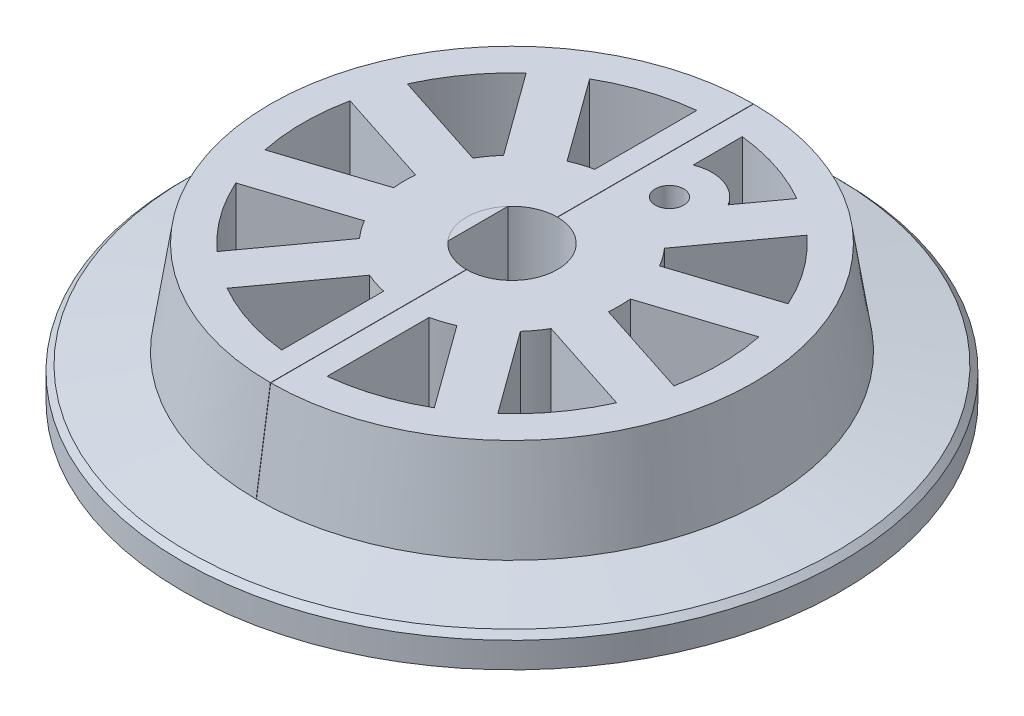
from build123d import *

# Parameters (mm, degrees)
SKETCH_4_R               = 11.6
SKETCH_4_R_2             = 1.6
EXTRUDE_1_DEPTH          = 1.1
EXTRUDE_START            = 1.5
SKETCH_4_3_R             = 9
SKETCH_4_3_R_2           = 1.6
EXTRUDE_2_DEPTH          = 3.3
CHAMFER_1_SIZE           = 0.2
SKETCH_4_4_R             = 1.6
CUT_EXTRUDE_2_DEPTH      = 18.092688495
CHAMFER_2_SIZE           = 0.5
CHAMFER_2_SIZE_2         = 3.3
CUT_EXTRUDE_4_DEPTH      = 18.092688495
EXTRUDE_3_DEPTH          = 4.8
PATTERN_CIRCULAR_2_COUNT = 10
SKETCH_6_R               = 1.5
EXTRUDE_4_DEPTH          = 4.8
SKETCH_6_3_R             = 0.5
CUT_EXTRUDE_5_DEPTH      = 18.092688495
EXTRUDE_5_DEPTH          = 4.8
SKETCH_7_W               = 0.01
SKETCH_7_H               = 22.799997808
CUT_EXTRUDE_6_DEPTH      = 3.3


with BuildPart() as part:
    # 草图4 → 凸台-拉伸1 (new body)
    with BuildSketch(Plane(origin=(0, 0, 0), x_dir=(1, 0, 0), z_dir=(0, 1, 0))):
        with Locations(Location((0, 0, 0), (0, 0, 270))):
            Circle(SKETCH_4_R)
        with Locations(Location((0, 0, 0), (0, 0, 270))):
            Circle(SKETCH_4_R_2, mode=Mode.SUBTRACT)
    extrude(amount=EXTRUDE_1_DEPTH)

    # 倒角1
    chamfer_1_edges = [part.edges().sort_by_distance(p)[0] for p in [
        (0, 1.1, -11.6),
    ]]
    chamfer(chamfer_1_edges, length=CHAMFER_1_SIZE)


with BuildPart() as body_2:
    # 草图4<3> → 凸台-拉伸2 (new body)
    with BuildSketch(Plane(origin=(0, 0, 0), x_dir=(1, 0, 0), z_dir=(0, 1, 0)).offset(EXTRUDE_START)):
        with Locations(Location((0, 0, 0), (0, 0, 270))):
            Circle(SKETCH_4_3_R)
        with Locations(Location((0, 0, 0), (0, 0, 270))):
            Circle(SKETCH_4_3_R_2, mode=Mode.SUBTRACT)
    extrude(amount=EXTRUDE_2_DEPTH)


    add(part.part)  # loft_1 joins it to this body
    # loft up to a face of the part (loft_1)
    loft([Face(Wire([body_2.edges().sort_by_distance((-6.560717647, 1.5, -6.160923953))[0]])), Face(Wire([body_2.edges().sort_by_distance((8.310242353, 1.1, -7.803837008))[0]]))])

    # 草图4<4> → 切除-拉伸2 (cut, through all)
    with BuildSketch(Plane(origin=(0, 0, 0), x_dir=(1, 0, 0), z_dir=(0, 1, 0))):
        with Locations(Location((0, 0, 0), (0, 0, 270))):
            Circle(SKETCH_4_4_R)
    extrude(amount=CUT_EXTRUDE_2_DEPTH, mode=Mode.SUBTRACT)

    # 倒角2
    # the kernel refuses this chamfer: 3.3, 0.5 mm, written as the material it takes off along each edge
    with BuildSketch(Plane(origin=(0, 4.8, 0), x_dir=(0, 0, 1), z_dir=(-1, 0, 0))) as chamfer_2_piece_1:
        Polygon((9 - CHAMFER_2_SIZE, 0), (9, -CHAMFER_2_SIZE_2), (9, 0), align=None)
    revolve(axis=Axis((0, 4.8, 0), (0, 1, 0)), mode=Mode.SUBTRACT)

    # 草图5 → 切除-拉伸4 (cut, through all)
    with BuildSketch(Plane(origin=(0, 4.8, 0), x_dir=(1, 0, 0), z_dir=(0, 1, 0))):
        with BuildLine():
            ThreePointArc((3.8, 0), (-2.387467277, -2.9563491), (-0.8, 3.714835124))
            Line((-0.8, 3.714835124), (-0.8, 7.30633287))
            ThreePointArc((-0.8, 7.30633287), (-4.906246019, -5.47277352), (7.35, 0))
            ThreePointArc((7.35, 0), (5.47277352, 4.906246019), (0.8, 7.30633287))
            Line((0.8, 7.30633287), (0.8, 3.714835124))
            ThreePointArc((0.8, 3.714835124), (2.9563491, 2.387467277), (3.8, 0))
        make_face()
        with BuildLine():
            Line((-0.8, 7.30633287), (-0.8, 3.714835124))
            ThreePointArc((-0.8, 3.714835124), (-0.402260194, 3.778648798), (0, 3.8))
            Line((0, 3.8), (0, 7.35))
            ThreePointArc((0, 7.35), (-0.400595438, 7.339075098), (-0.8, 7.30633287))
        make_face()
        with BuildLine():
            Line((0, 7.35), (0, 3.8))
            ThreePointArc((0, 3.8), (0.402260194, 3.778648798), (0.8, 3.714835124))
            Line((0.8, 3.714835124), (0.8, 7.30633287))
            ThreePointArc((0.8, 7.30633287), (0.400595438, 7.339075098), (0, 7.35))
        make_face()
    extrude(amount=-CUT_EXTRUDE_4_DEPTH, mode=Mode.SUBTRACT)


with BuildPart() as cut_extrude_4_piece_1:
    # of the separate pieces the step leaves, piece 1, a body of its own (cut_extrude_4_pieces)
    add(body_2.part.solids().sort_by_distance((0, 0.9, 11.6))[0])

    # 草图5<4> → 凸台-拉伸3 (add)
    with BuildSketch(Plane(origin=(0, 4.8, 0), x_dir=(1, 0, 0), z_dir=(0, 1, 0))):
        with BuildLine():
            Line((0, 7.35), (0, 3.8))
            ThreePointArc((0, 3.8), (0.402260194, 3.778648798), (0.8, 3.714835124))
            Line((0.8, 3.714835124), (0.8, 7.30633287))
            ThreePointArc((0.8, 7.30633287), (0.400595438, 7.339075098), (0, 7.35))
        make_face()
        with BuildLine():
            Line((-0.8, 7.30633287), (-0.8, 3.714835124))
            ThreePointArc((-0.8, 3.714835124), (-0.402260194, 3.778648798), (0, 3.8))
            Line((0, 3.8), (0, 7.35))
            ThreePointArc((0, 7.35), (-0.400595438, 7.339075098), (-0.8, 7.30633287))
        make_face()
    extrude_3 = extrude(amount=-EXTRUDE_3_DEPTH)

    # 阵列(圆周)2: 凸台-拉伸3 ×10 about axis
    pattern_circular_2_axis = Axis((0, 0, 0), (0, 1, 0))
    for i in range(1, PATTERN_CIRCULAR_2_COUNT):
        add(extrude_3.rotate(pattern_circular_2_axis, i * 360 / PATTERN_CIRCULAR_2_COUNT))



with BuildPart() as cut_extrude_4_piece_2:
    # of the separate pieces the step leaves, piece 2, a body of its own (cut_extrude_4_pieces)
    add(body_2.part.solids().sort_by_distance((-0.8, 0, -3.714835124))[0])


with BuildPart() as cut_extrude_4_piece_1_1:
    add(cut_extrude_4_piece_1.part)

    add(cut_extrude_4_piece_2.part)  # 凸台-拉伸4 merges 切除-拉伸4 piece 2
    # 草图6 → 凸台-拉伸4 (add, through all)
    with BuildSketch(Plane(origin=(0, 4.8, 0), x_dir=(1, 0, 0), z_dir=(0, 1, 0))):
        with Locations((1.359674775, 4.184648672)):
            Circle(SKETCH_6_R)
    extrude(amount=-EXTRUDE_4_DEPTH)

    # 草图6<3> → 切除-拉伸5 (cut, through all)
    with BuildSketch(Plane(origin=(0, 4.8, 0), x_dir=(1, 0, 0), z_dir=(0, 1, 0))):
        with Locations(Location((1.359674775, 4.184648672, 0), (0, 0, 270))):
            Circle(SKETCH_6_3_R)
    extrude(amount=-CUT_EXTRUDE_5_DEPTH, mode=Mode.SUBTRACT)

    # 草图7 → 切除-拉伸6 (cut)
    with BuildSketch(Plane(origin=(0, 4.8, 0), x_dir=(1, 0, 0), z_dir=(0, 1, 0))):
        Rectangle(SKETCH_7_W, SKETCH_7_H)
    extrude(amount=-CUT_EXTRUDE_6_DEPTH, mode=Mode.SUBTRACT)


with BuildPart() as body_2_2:
    # 草图4<6> → 凸台-拉伸5 (new body)
    with BuildSketch(Plane(origin=(0, 0, 0), x_dir=(1, 0, 0), z_dir=(0, 1, 0))):
        with BuildLine():
            Line((-1.2, -1.058300524), (-1.2, 1.058300524))
            ThreePointArc((-1.2, 1.058300524), (-1.6, 0), (-1.2, -1.058300524))
        make_face()
    extrude(amount=EXTRUDE_5_DEPTH)


solid = Compound([cut_extrude_4_piece_1_1.part, body_2_2.part])
